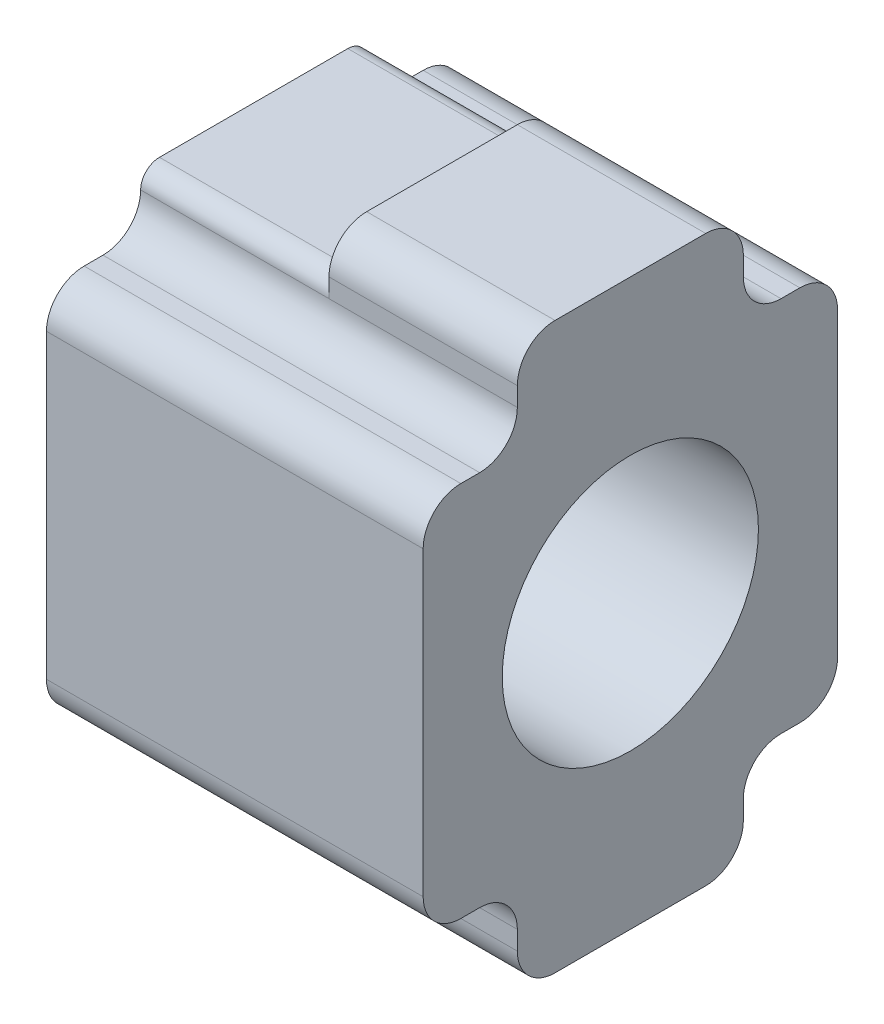
from build123d import *

# Parameters (mm, degrees)
SKETCH1_W           = 11
SKETCH1_H           = 15
BOSS_EXTRUDE1_DEPTH = 10
SKETCH3_R           = 3.4
CUT_EXTRUDE1_DEPTH  = 22.118712082
CUT_EXTRUDE2_DEPTH  = 22.118712082
FILLET1_R           = 1
SKETCH5_W           = 30.35499422
SKETCH5_H           = 5.878934171
SKETCH5_W_2         = 28.690297522
SKETCH5_H_2         = 3.597414723
CUT_EXTRUDE3_DEPTH  = 5
FILLET2_R           = 0.5


with BuildPart() as part:
    # Sketch1 → Boss-Extrude1 (new body)
    with BuildSketch(Plane(origin=(0, 0, 0), x_dir=(0, 0, -1), z_dir=(1, 0, 0))):
        with Locations((5.5, 7.5)):
            Rectangle(SKETCH1_W, SKETCH1_H)
    extrude(amount=BOSS_EXTRUDE1_DEPTH)

    # Sketch3 → Cut-Extrude1 (cut, through all)
    with BuildSketch(Plane.ZY):
        with Locations((-5.5, 7.5)):
            Circle(SKETCH3_R)
    extrude(amount=-CUT_EXTRUDE1_DEPTH, mode=Mode.SUBTRACT)

    # Sketch4 → Cut-Extrude2 (cut, through all)
    with BuildSketch(Plane.ZY):
        with BuildLine():
            Line((-8.5, 15), (-8.5, 13.5))
            ThreePointArc((-8.5, 13.5), (-8.792893219, 12.792893219), (-9.5, 12.5))
            Line((-9.5, 12.5), (-12.5, 12.5))
            Line((-12.5, 12.5), (-12.5, 2.5))
            Line((-12.5, 2.5), (-9.5, 2.5))
            ThreePointArc((-9.5, 2.5), (-8.792893219, 2.207106781), (-8.5, 1.5))
            Line((-8.5, 1.5), (-8.5, 0))
            Line((-8.5, 0), (-16.5, 0))
            Line((-16.5, 0), (-16.5, 15))
            Line((-16.5, 15), (-8.5, 15))
        make_face()
        with BuildLine():
            Line((-2.5, 1.5), (-2.5, 0))
            Line((-2.5, 0), (6, 0))
            Line((6, 0), (6, 15))
            Line((6, 15), (-2.5, 15))
            Line((-2.5, 15), (-2.5, 13.5))
            ThreePointArc((-2.5, 13.5), (-2.207106781, 12.792893219), (-1.5, 12.5))
            Line((-1.5, 12.5), (1.5, 12.5))
            Line((1.5, 12.5), (1.5, 2.5))
            Line((1.5, 2.5), (-1.5, 2.5))
            ThreePointArc((-1.5, 2.5), (-2.207106781, 2.207106781), (-2.5, 1.5))
        make_face()
    extrude(amount=-CUT_EXTRUDE2_DEPTH, mode=Mode.SUBTRACT)

    # Fillet1
    fillet1_edges = [part.edges().sort_by_distance(p)[0] for p in [
        (5, 12.5, -11),
        (5, 2.5, -11),
        (5, 0, -8.5),
        (5, 15, -8.5),
        (5, 15, -2.5),
        (5, 2.5, 0),
        (5, 12.5, 0),
        (5, 0, -2.5),
    ]]
    fillet(fillet1_edges, radius=FILLET1_R)

    # Sketch5 → Cut-Extrude3 (cut)
    with BuildSketch(Plane.ZY):
        with Locations((-1.883853424, 16.939467085)):
            Rectangle(SKETCH5_W, SKETCH5_H)
        with Locations((-4.752769967, -0.798707361)):
            Rectangle(SKETCH5_W_2, SKETCH5_H_2)
    extrude(amount=-CUT_EXTRUDE3_DEPTH, mode=Mode.SUBTRACT)

    # Fillet2
    fillet2_edges = [part.edges().sort_by_distance(p)[0] for p in [
        (2.5, 1, -8.5),
        (2.5, 1, -2.5),
        (2.5, 14, -8.5),
        (2.5, 14, -2.5),
    ]]
    fillet(fillet2_edges, radius=FILLET2_R - 0.0001)  # a hair under: the kernel refuses the full size


solid = part.part
